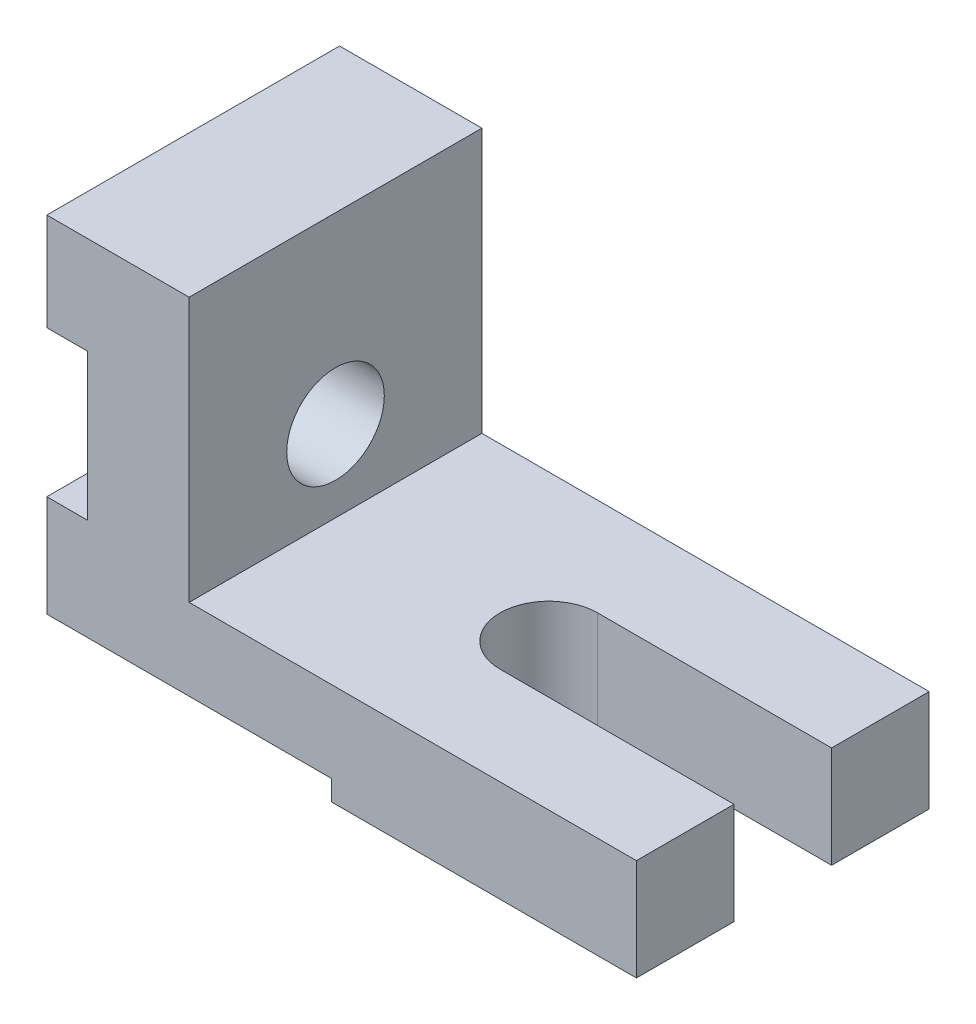
from build123d import *

# Parameters (mm, degrees)
BOSS_EXTRUDE1_DEPTH = 25
SKETCH2_3_W         = 35
SKETCH2_3_H         = 72
BOSS_EXTRUDE2_DEPTH = 90
SKETCH4_W           = 70
SKETCH4_H           = 5
CUT_EXTRUDE1_DEPTH  = 50
SKETCH5_R           = 12
CUT_EXTRUDE2_DEPTH  = 10
CUT_EXTRUDE3_REACH  = 187.227
SKETCH6_R           = 12


with BuildPart() as part:
    # Sketch2 → Boss-Extrude1 (new body)
    with BuildSketch(Plane(origin=(0, 0, 0), x_dir=(1, 0, 0), z_dir=(0, 1, 0))):
        with BuildLine():
            Line((87.454359696, 48), (145, 48))
            Line((145, 48), (145, 72))
            Line((145, 72), (35, 72))
            Line((35, 72), (35, 0))
            Line((35, 0), (145, 0))
            Line((145, 0), (145, 24))
            Line((145, 24), (87.454359696, 24))
            ThreePointArc((87.454359696, 24), (75.454359696, 36), (87.454359696, 48))
        make_face()
    extrude(amount=BOSS_EXTRUDE1_DEPTH)

    # Sketch2<3> → Boss-Extrude2 (add)
    with BuildSketch(Plane(origin=(0, 0, 0), x_dir=(1, 0, 0), z_dir=(0, 1, 0))):
        with Locations((17.5, 36)):
            Rectangle(SKETCH2_3_W, SKETCH2_3_H)
    extrude(amount=BOSS_EXTRUDE2_DEPTH)

    # Sketch4 → Cut-Extrude1 (cut)
    with BuildSketch(Plane.XY):
        with Locations((35, 2.5)):
            Rectangle(SKETCH4_W, SKETCH4_H)
    extrude(amount=-CUT_EXTRUDE1_DEPTH, mode=Mode.SUBTRACT)

    # Sketch5 → Cut-Extrude2 (cut)
    with BuildSketch(Plane.ZY):
        with BuildLine():
            Line((-72, 66), (-72, 30))
            Line((-72, 30), (-61.980762114, 30))
            ThreePointArc((-61.980762114, 30), (-36, 15), (-10.019237886, 30))
            Line((-10.019237886, 30), (0, 30))
            Line((0, 30), (0, 66))
            Line((0, 66), (-14.575714714, 66))
            ThreePointArc((-14.575714714, 66), (-36, 75), (-57.424285286, 66))
            Line((-57.424285286, 66), (-72, 66))
        make_face()
        with Locations((-36, 45)):
            Circle(SKETCH5_R, mode=Mode.SUBTRACT)
    extrude(amount=-CUT_EXTRUDE2_DEPTH, mode=Mode.SUBTRACT)

    # Sketch6 → Cut-Extrude3 (cut, up to next)
    with BuildSketch(Plane.ZY, mode=Mode.PRIVATE) as cut_extrude3_sk1:
        with Locations((-36, 45)):
            Circle(SKETCH6_R)
    cut_extrude3_tool1 = extrude(cut_extrude3_sk1.sketch, amount=-CUT_EXTRUDE3_REACH, mode=Mode.PRIVATE) & part.part
    add(cut_extrude3_tool1.solids().sort_by_distance((0, 45, -36))[0], mode=Mode.SUBTRACT)


solid = part.part
